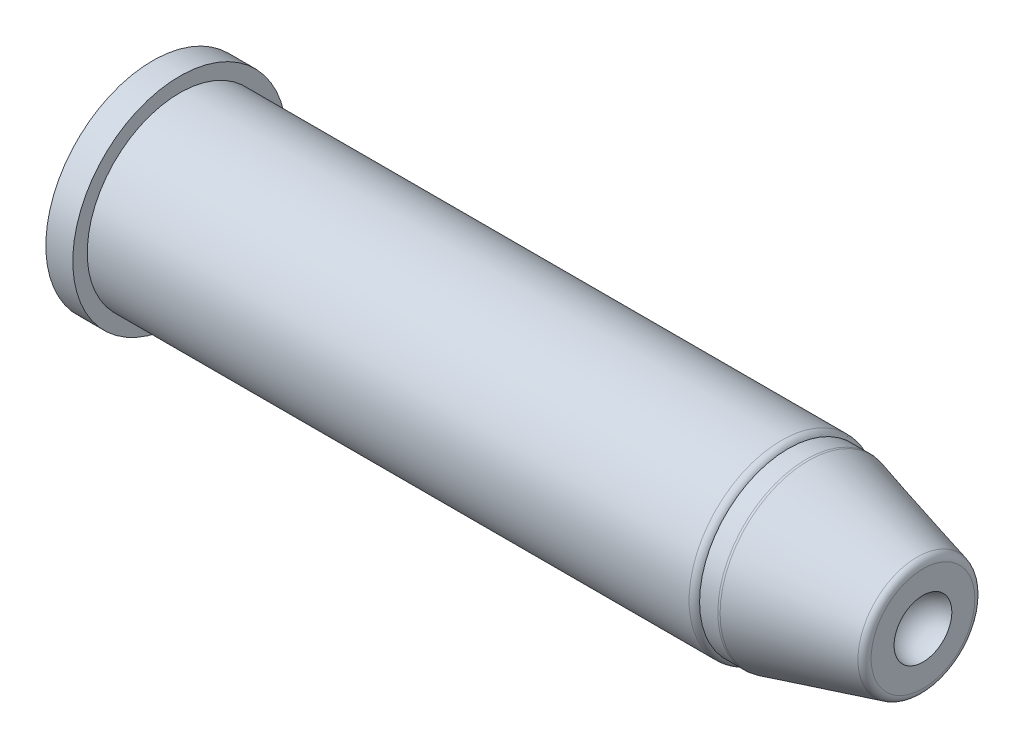
from build123d import *

# Parameters (mm, degrees)
FILETE1_R = 0.4
FILETE2_R = 0.4
FILETE3_R = 0.4


with BuildPart() as part:
    # Esboço1 → Revolução1 (revolve)
    with BuildSketch(Plane.XY, mode=Mode.PRIVATE) as revolu_o1_sk:
        with BuildLine():
            Line((0, 0), (0, 5.55))
            Line((0, 5.55), (1.4, 5.55))
            Line((1.4, 5.55), (1.4, 4.8))
            Line((1.4, 4.8), (33, 4.8))
            Line((33, 4.8), (33, 4.6))
            Line((33, 4.6), (34, 4.6))
            Line((34, 4.6), (40, 3))
            Line((40, 3), (40, 1.5))
            ThreePointArc((40, 1.5), (38.939339828, 1.060660172), (38.5, 0))
            Line((38.5, 0), (0, 0))
        make_face()
    revolve(revolu_o1_sk.sketch.rotate(Axis((38.5, 0, 0), (-1, 0, 0)), 90), axis=Axis((38.5, 0, 0), (-1, 0, 0)))

    # Filete1
    # the kernel refuses this fillet: 0.4 mm, written as the material it takes off along each edge
    with BuildSketch(Plane(origin=(33, 0, 0), x_dir=(0, 0, -1), z_dir=(0, 1, 0))) as filete1_piece_1:
        with BuildLine():
            CenterArc((4.4, 0.346410162), FILETE1_R, 300, 60)
            Line((4.6, 0), (4.604, -0.006928203))
            ThreePointArc((4.604, -0.006928203), (4.7, -0.008), (4.8, -0.008))
            Line((4.8, -0.008), (4.808, 0))
            Line((4.808, 0), (4.808, 0.346410162))
            Line((4.808, 0.346410162), (4.8, 0.346410162))
        make_face()
    revolve(axis=Axis((33, 0, 0), (-1, 0, 0)), mode=Mode.SUBTRACT)

    # Filete2
    filete2_edges = [part.edges().sort_by_distance(p)[0] for p in [
        (34, 0, 4.6),
    ]]
    fillet(filete2_edges, radius=FILETE2_R)

    # Filete3
    filete3_edges = [part.edges().sort_by_distance(p)[0] for p in [
        (40, 0, 3),
    ]]
    fillet(filete3_edges, radius=FILETE3_R)


solid = part.part
